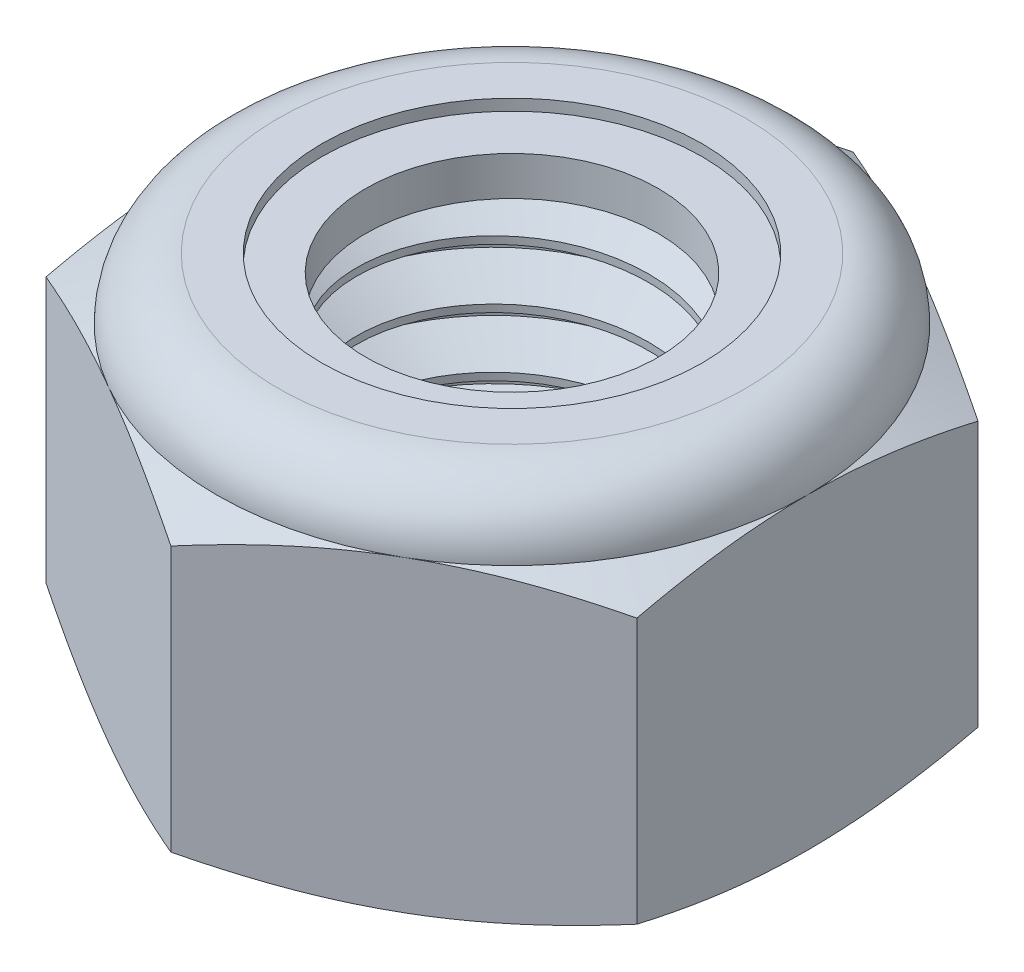
from build123d import *

# Parameters (mm, degrees)
EXTRUDE1_DEPTH   = 5
SKETCH2_W        = 2.5
SKETCH2_H        = 5
CUT_SWEEP1_PITCH = 0.8


with BuildPart() as part:
    # Sketch1 → Extrude1 (new body)
    with BuildSketch(Plane(origin=(0, 0, 0), x_dir=(1, 0, 0), z_dir=(0, 1, 0))):
        Polygon((0, 4.618802154), (-4, 2.309401077), (-4, -2.309401077), (0, -4.618802154), (4, -2.309401077), (4, 2.309401077), align=None)
    extrude(amount=EXTRUDE1_DEPTH)


with BuildPart() as body_2:
    # Sketch2 → Revolve1 (revolve)
    with BuildSketch(Plane(origin=(0, 0, 0), x_dir=(0, 0, -1), z_dir=(1, 0, 0))):
        with Locations((1.25, 2.5)):
            Rectangle(SKETCH2_W, SKETCH2_H)
    revolve(axis=Axis((0, -2.5, 0), (0, 1, 0)))

    # Cut-Sweep1: the profile of Sketch9 profile screwed along a right-hand helix of 7.25 turns, 8 arcs to a turn; built about Z, then put on its axis
    cut_sweep1_z = Axis((0, 0, 0), (0, 0, 1))
    cut_sweep1_corners = [(2.5003, 0, -0.700173205), (2.5003, 0, 0.000173205), (1.980384758, 0, -0.3), (1.980384758, 0, -0.4)]
    with BuildLine(mode=Mode.PRIVATE) as cut_sweep1_profile:
        Line(cut_sweep1_corners[0], cut_sweep1_corners[1])
        Line(cut_sweep1_corners[1], cut_sweep1_corners[2])
        Line(cut_sweep1_corners[2], cut_sweep1_corners[3])
        Line(cut_sweep1_corners[3], cut_sweep1_corners[0])
    cut_sweep1_cap = Face(cut_sweep1_profile.wire())
    cut_sweep1_turn_angles = [0, 22.5, 45, 67.5, 90, 112.5, 135, 157.5, 180, 202.5, 225, 247.5, 270, 292.5, 315, 337.5, 360]
    cut_sweep1_turn_weights = [1, 0.9238795325112867, 1, 0.9238795325112867, 1, 0.9238795325112867, 1, 0.9238795325112867, 1, 0.9238795325112867, 1, 0.9238795325112867, 1, 0.9238795325112867, 1, 0.9238795325112867, 1]
    cut_sweep1_turn_rails = [Edge.make_bspline([Vector(p[0], p[1], 0).rotate(cut_sweep1_z, cut_sweep1_turn_angles[k]) / cut_sweep1_turn_weights[k] + Vector(0, 0, p[2] + CUT_SWEEP1_PITCH * cut_sweep1_turn_angles[k] / 360) for k in range(17)], [0, 0, 0, 1, 1, 2, 2, 3, 3, 4, 4, 5, 5, 6, 6, 7, 7, 8, 8, 8], 2, cut_sweep1_turn_weights) for p in cut_sweep1_corners]
    cut_sweep1_turn_sides = [Face.make_surface_from_curves(cut_sweep1_turn_rails[p[0]], cut_sweep1_turn_rails[p[1]]) for p in [(0, 1), (1, 2), (2, 3), (3, 0)]]
    cut_sweep1_last_angles = [2520, 2542.5, 2565, 2587.5, 2610]
    cut_sweep1_last_weights = [1, 0.9238795325112867, 1, 0.923879532511299, 1]
    cut_sweep1_last_rails = [Edge.make_bspline([Vector(p[0], p[1], 0).rotate(cut_sweep1_z, cut_sweep1_last_angles[k]) / cut_sweep1_last_weights[k] + Vector(0, 0, p[2] + CUT_SWEEP1_PITCH * cut_sweep1_last_angles[k] / 360) for k in range(5)], [0, 0, 0, 1, 1, 2, 2, 2], 2, cut_sweep1_last_weights) for p in cut_sweep1_corners]
    cut_sweep1_last_sides = [Face.make_surface_from_curves(cut_sweep1_last_rails[p[0]], cut_sweep1_last_rails[p[1]]) for p in [(0, 1), (1, 2), (2, 3), (3, 0)]]
    cut_sweep1 = Plane(origin=(0, 0, 0), x_dir=(0, 0, -1), z_dir=(0, 1, 0)) * Solid(Shell([*[p.moved(Location((0, 0, CUT_SWEEP1_PITCH * i))) for i in range(7) for p in cut_sweep1_turn_sides], *cut_sweep1_last_sides, cut_sweep1_cap, cut_sweep1_cap.rotate(cut_sweep1_z, 2610).moved(Location((0, 0, CUT_SWEEP1_PITCH * 2610 / 360)))]))
    add(cut_sweep1, mode=Mode.SUBTRACT)

    # Boss-Extrude1 cone 1 section (through the dimple's axis) → Boss-Extrude1 (revolve)
    with BuildSketch(Plane(origin=(0, 0, 0), x_dir=(0, 0, -1), z_dir=(1, 0, 0))):
        Polygon((0, 0), (2.5, 0), (0, 2.5), align=None)
    revolve(axis=Axis((0, 0, 0), (0, 1, 0)))

    # Boss-Extrude2 cone 1 section (through the dimple's axis) → Boss-Extrude2 (revolve)
    with BuildSketch(Plane(origin=(0, 5, 0), x_dir=(0, 0, 1), z_dir=(1, 0, 0))):
        Polygon((0, 0), (2.5, 0), (0, 2.5), align=None)
    revolve(axis=Axis((0, 5, 0), (0, -1, 0)))


with BuildPart() as part_1:
    add(part.part)

    # Combine1: cut body 2
    add(body_2.part, mode=Mode.SUBTRACT)

    # Sketch5 → Cut-Revolve3 (revolve, cut)
    with BuildSketch(Plane(origin=(0, 0, 0), x_dir=(0, 0, -1), z_dir=(1, 0, 0))):
        with BuildLine():
            Line((0, 0), (4, 0))
            Line((4, 0), (4.618802154, 0.288552183))
            Line((4.618802154, 0.288552183), (4.618802154, 3.878114484))
            Line((4.618802154, 3.878114484), (4, 4.166666667))
            ThreePointArc((4, 4.166666667), (3.755922318, 4.755922318), (3.166666667, 5))
            Line((3.166666667, 5), (3.166666667, 6.27))
            Line((3.166666667, 6.27), (5.888802154, 6.27))
            Line((5.888802154, 6.27), (5.888802154, -1.27))
            Line((5.888802154, -1.27), (0, -1.27))
            Line((0, -1.27), (0, 0))
        make_face()
    revolve(axis=Axis((0, 0, 0), (0, 1, 0)), mode=Mode.SUBTRACT)

    # Sketch6 → Cut-Revolve4 (revolve, cut)
    with BuildSketch(Plane(origin=(0, 0, 0), x_dir=(0, 0, -1), z_dir=(1, 0, 0)), mode=Mode.PRIVATE) as cut_revolve4_sk:
        with BuildLine():
            Line((0, 4.166666667), (3.8476, 4.166666667))
            ThreePointArc((3.8476, 4.166666667), (3.648159244, 4.648159244), (3.166666667, 4.8476))
            Line((3.166666667, 4.8476), (2.573525712, 4.8476))
            Line((2.573525712, 4.8476), (2.573525712, 6.27))
            Line((2.573525712, 6.27), (0, 6.27))
            Line((0, 6.27), (0, 4.166666667))
        make_face()
    revolve(cut_revolve4_sk.sketch.rotate(Axis((0, 6.27, 0), (0, -1, 0)), 180), axis=Axis((0, 6.27, 0), (0, -1, 0)), mode=Mode.SUBTRACT)


with BuildPart() as body_2_2:
    # Sketch7 → Revolve2 (revolve)
    with BuildSketch(Plane(origin=(0, 0, 0), x_dir=(0, 0, -1), z_dir=(1, 0, 0))):
        with BuildLine():
            Line((1.980384758, 4.242866667), (3.766579964, 4.242866667))
            ThreePointArc((3.766579964, 4.242866667), (3.566430175, 4.620419399), (3.166666667, 4.7714))
            Line((3.166666667, 4.7714), (1.980384758, 4.7714))
            Line((1.980384758, 4.7714), (1.980384758, 4.242866667))
        make_face()
    revolve(axis=Axis((0, 4.242866667, 0), (0, 1, 0)))


solid = Compound([part_1.part, body_2_2.part])
